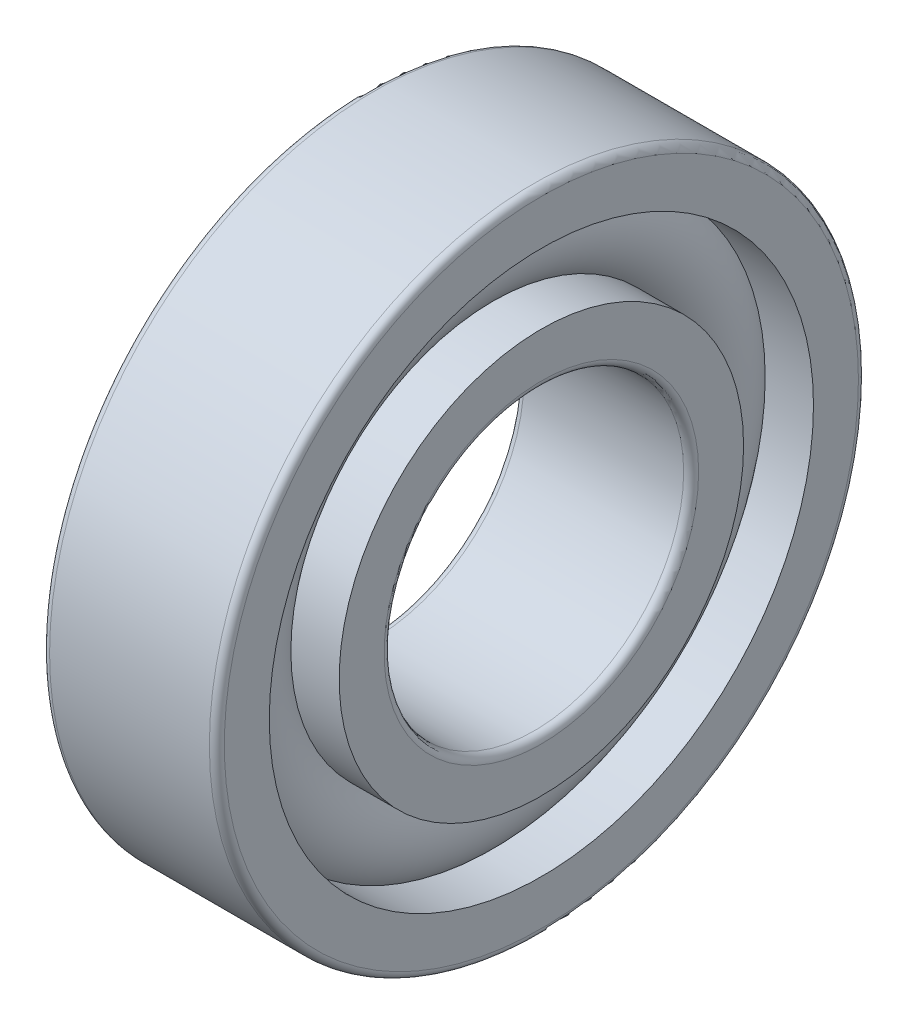
from build123d import *

# Parameters (mm, degrees)
CAGSPISKE_W     = 0.21
CAGSPISKE_H     = 0.35
CAGESPINE_ANGLE = 0.001
BALSIMSKE_R     = 1.05


with BuildPart() as part:
    # CagSpiSke → CageSpine (revolve)
    with BuildSketch(Plane.XY):
        with Locations((0, 4.75)):
            Rectangle(CAGSPISKE_W, CAGSPISKE_H)
    revolve(axis=Axis((-20.6375, 0, 0), (-1, 0, 0)), revolution_arc=CAGESPINE_ANGLE)

    # BalSimSke → BallsSimplified (revolve)
    with BuildSketch(Plane.XY):
        with Locations((0, 4.75)):
            Circle(BALSIMSKE_R)
    revolve(axis=Axis((-10, 0, 0), (1, 0, 0)))

    # InnRacSke → InnerRace (revolve)
    with BuildSketch(Plane.XY):
        with BuildLine():
            Line((-0.748748957, 4.05), (-1.75, 4.05))
            Line((-1.75, 4.05), (-1.75, 3.15))
            ThreePointArc((-1.75, 3.15), (-1.706066017, 3.043933983), (-1.6, 3))
            Line((-1.6, 3), (1.6, 3))
            ThreePointArc((1.6, 3), (1.706066017, 3.043933983), (1.75, 3.15))
            Line((1.75, 3.15), (1.75, 4.05))
            Line((1.75, 4.05), (0.748748957, 4.05))
            ThreePointArc((0.748748957, 4.05), (0, 3.725), (-0.748748957, 4.05))
        make_face()
    revolve(axis=Axis((-20.6375, 0, 0), (1, 0, 0)))

    # OutRacSke → OuterRace (revolve)
    with BuildSketch(Plane.XY):
        with BuildLine():
            Line((-0.748748957, 5.45), (-1.75, 5.45))
            Line((-1.75, 5.45), (-1.75, 6.35))
            ThreePointArc((-1.75, 6.35), (-1.706066017, 6.456066017), (-1.6, 6.5))
            Line((-1.6, 6.5), (1.6, 6.5))
            ThreePointArc((1.6, 6.5), (1.706066017, 6.456066017), (1.75, 6.35))
            Line((1.75, 6.35), (1.75, 5.45))
            Line((1.75, 5.45), (0.748748957, 5.45))
            ThreePointArc((0.748748957, 5.45), (0, 5.775), (-0.748748957, 5.45))
        make_face()
    revolve(axis=Axis((-20.6375, 0, 0), (1, 0, 0)))


solid = part.part
